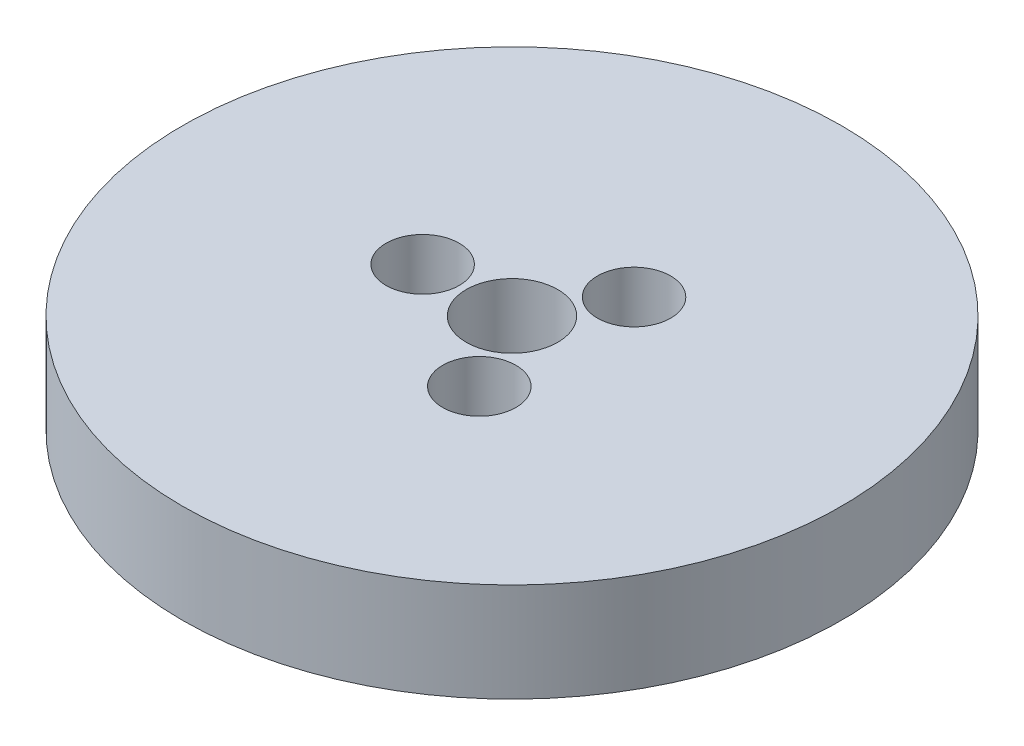
from build123d import *

# Parameters (mm, degrees)
SKETCH1_R           = 90
BOSS_EXTRUDE1_DEPTH = 27
SKETCH2_R           = 12.5
CUT_EXTRUDE1_DEPTH  = 131.111490653
SKETCH3_R           = 10
CUT_EXTRUDE2_DEPTH  = 24.738238351
CIRPATTERN1_COUNT   = 3


with BuildPart() as part:
    # Sketch1 → Boss-Extrude1 (new body)
    with BuildSketch(Plane(origin=(0, 0, 0), x_dir=(1, 0, 0), z_dir=(0, 1, 0))):
        Circle(SKETCH1_R)
    extrude(amount=BOSS_EXTRUDE1_DEPTH)

    # Sketch2 → Cut-Extrude1 (cut, through all)
    with BuildSketch(Plane(origin=(0, 0, 0), x_dir=(1, 0, 0), z_dir=(0, 1, 0))):
        Circle(SKETCH2_R)
    extrude(amount=CUT_EXTRUDE1_DEPTH, mode=Mode.SUBTRACT)

    # Sketch3 → Cut-Extrude2 (cut)
    with BuildSketch(Plane(origin=(0, 27, 0), x_dir=(1, 0, 0), z_dir=(0, 1, 0))):
        with Locations((-24.400327763, 0)):
            Circle(SKETCH3_R)
    cut_extrude2 = extrude(amount=-CUT_EXTRUDE2_DEPTH, mode=Mode.SUBTRACT)

    # CirPattern1: Cut-Extrude2 ×3 about axis
    cirpattern1_axis = Axis((0, 0, 0), (0, 1, 0))
    for i in range(1, CIRPATTERN1_COUNT):
        add(cut_extrude2.rotate(cirpattern1_axis, i * 360 / CIRPATTERN1_COUNT), mode=Mode.SUBTRACT)


solid = part.part
